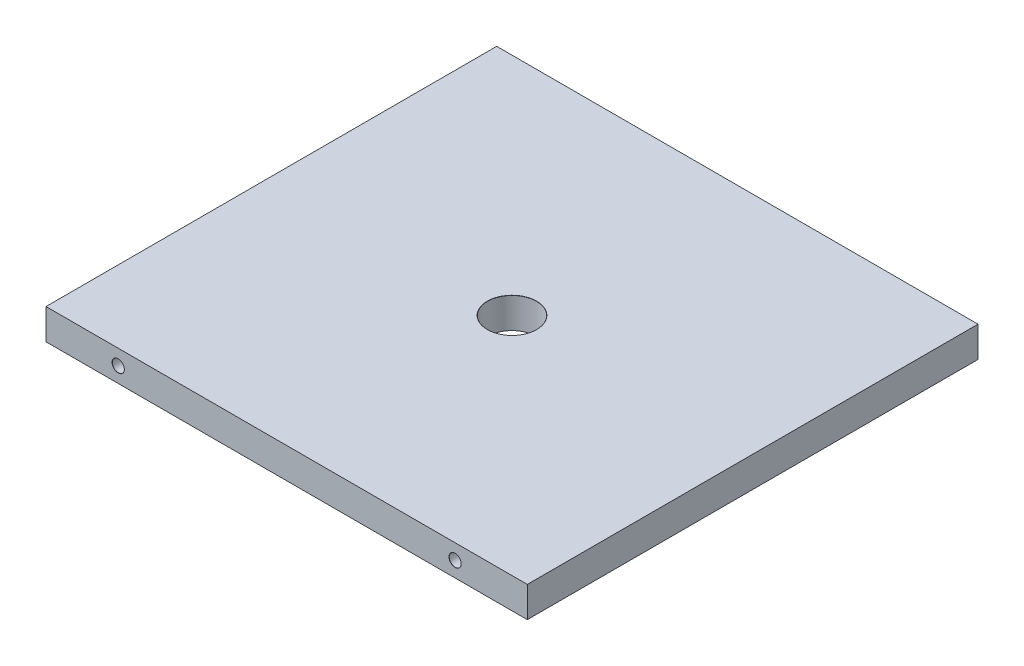
from build123d import *

# Parameters (mm, degrees)
SKETCH1_W                               = 100
SKETCH1_H                               = 93.65
BOSS_EXTRUDE1_DEPTH                     = 6.35
TAP_DRILL_FOR_M3X0_5_TAP1_D             = 2.5
TAP_DRILL_FOR_M3X0_5_TAP1_DEPTH         = 9.248924226
TAP_DRILL_FOR_M3X0_5_TAP1_CSINK_D       = 2.55
TAP_DRILL_FOR_M3X0_5_TAP1_CSINK_ANGLE   = 90
TAP_DRILL_FOR_M3X0_5_TAP1_TIP           = 0.751075774
TAP_DRILL_FOR_M3X0_5_TAP2_D             = 2.5
TAP_DRILL_FOR_M3X0_5_TAP2_DEPTH         = 9.248924226
TAP_DRILL_FOR_M3X0_5_TAP2_CSINK_D       = 2.55
TAP_DRILL_FOR_M3X0_5_TAP2_CSINK_ANGLE   = 90
TAP_DRILL_FOR_M3X0_5_TAP2_TIP           = 0.751075774
TAP_DRILL_FOR_M12X1_75_TAP1_D           = 10.2
TAP_DRILL_FOR_M12X1_75_TAP1_CSINK_D     = 10.25
TAP_DRILL_FOR_M12X1_75_TAP1_CSINK_ANGLE = 90


with BuildPart() as part:
    # Sketch1 → Boss-Extrude1 (new body)
    with BuildSketch(Plane(origin=(0, 0, 0), x_dir=(1, 0, 0), z_dir=(0, 1, 0))):
        Rectangle(SKETCH1_W, SKETCH1_H)
    extrude(amount=BOSS_EXTRUDE1_DEPTH)

    # Tap Drill for M3x0.5 Tap1
    with Locations(Plane.XY.offset(46.825)):
        with Locations((-35, 3.175), (35, 3.175)):
            CounterSinkHole(TAP_DRILL_FOR_M3X0_5_TAP1_D / 2, TAP_DRILL_FOR_M3X0_5_TAP1_CSINK_D / 2, depth=TAP_DRILL_FOR_M3X0_5_TAP1_DEPTH, counter_sink_angle=TAP_DRILL_FOR_M3X0_5_TAP1_CSINK_ANGLE)
            with Locations((0, 0, -(TAP_DRILL_FOR_M3X0_5_TAP1_DEPTH + TAP_DRILL_FOR_M3X0_5_TAP1_TIP / 2))):  # 118° drill point
                Cone(0, TAP_DRILL_FOR_M3X0_5_TAP1_D / 2, TAP_DRILL_FOR_M3X0_5_TAP1_TIP, mode=Mode.SUBTRACT)

    # Tap Drill for M3x0.5 Tap2
    with Locations(Plane(origin=(0, 0, -46.825), x_dir=(-1, 0, 0), z_dir=(0, 0, -1))):
        with Locations((-35, 3.175), (35, 3.175)):
            CounterSinkHole(TAP_DRILL_FOR_M3X0_5_TAP2_D / 2, TAP_DRILL_FOR_M3X0_5_TAP2_CSINK_D / 2, depth=TAP_DRILL_FOR_M3X0_5_TAP2_DEPTH, counter_sink_angle=TAP_DRILL_FOR_M3X0_5_TAP2_CSINK_ANGLE)
            with Locations((0, 0, -(TAP_DRILL_FOR_M3X0_5_TAP2_DEPTH + TAP_DRILL_FOR_M3X0_5_TAP2_TIP / 2))):  # 118° drill point
                Cone(0, TAP_DRILL_FOR_M3X0_5_TAP2_D / 2, TAP_DRILL_FOR_M3X0_5_TAP2_TIP, mode=Mode.SUBTRACT)

    # Tap Drill for M12x1.75 Tap1 (through all)
    with Locations(Plane(origin=(0, 6.35, 0), x_dir=(1, 0, 0), z_dir=(0, 1, 0))):
        with Locations((0, 0)):
            CounterSinkHole(TAP_DRILL_FOR_M12X1_75_TAP1_D / 2, TAP_DRILL_FOR_M12X1_75_TAP1_CSINK_D / 2, counter_sink_angle=TAP_DRILL_FOR_M12X1_75_TAP1_CSINK_ANGLE)


solid = part.part
